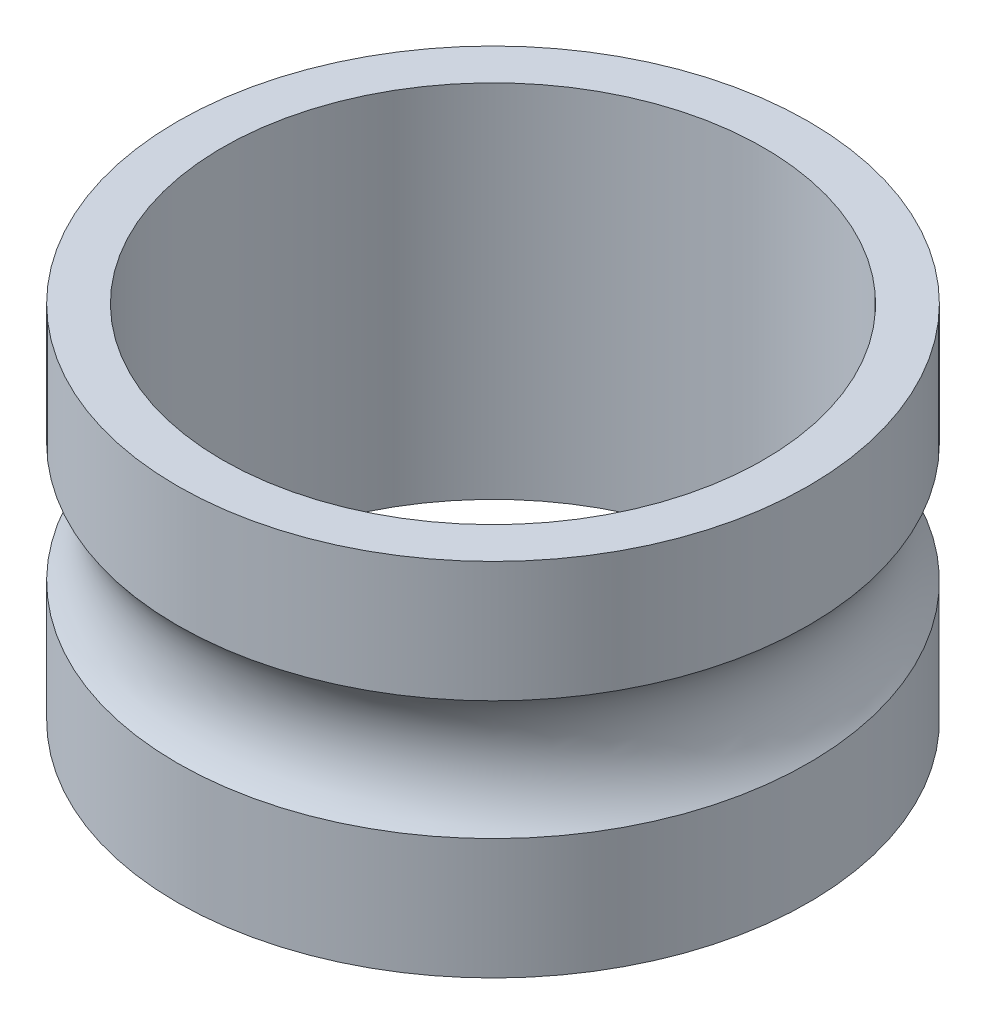
from build123d import *

# Parameters (mm, degrees)
DIAPROFILES_R         = 1.75
DIAPROFILES_R_2       = 1.5
DIAPROFILE_DEPTH      = 1
BEARINGPATHPROFILES_R = 0.5


with BuildPart() as part:
    # DiaProfileS → DiaProfile (new, symmetric)
    with BuildSketch(Plane(origin=(0, 0, 0), x_dir=(1, 0, 0), z_dir=(0, 1, 0))):
        Circle(DIAPROFILES_R)
        Circle(DIAPROFILES_R_2, mode=Mode.SUBTRACT)
    extrude(amount=DIAPROFILE_DEPTH, both=True)

    # BearingPathProfileS → BearingPathProfile (revolve, cut)
    with BuildSketch(Plane.XY):
        with Locations((2.125, 0)):
            Circle(BEARINGPATHPROFILES_R)
    revolve(axis=Axis((0, 1, 0), (0, -1, 0)), mode=Mode.SUBTRACT)


solid = part.part
